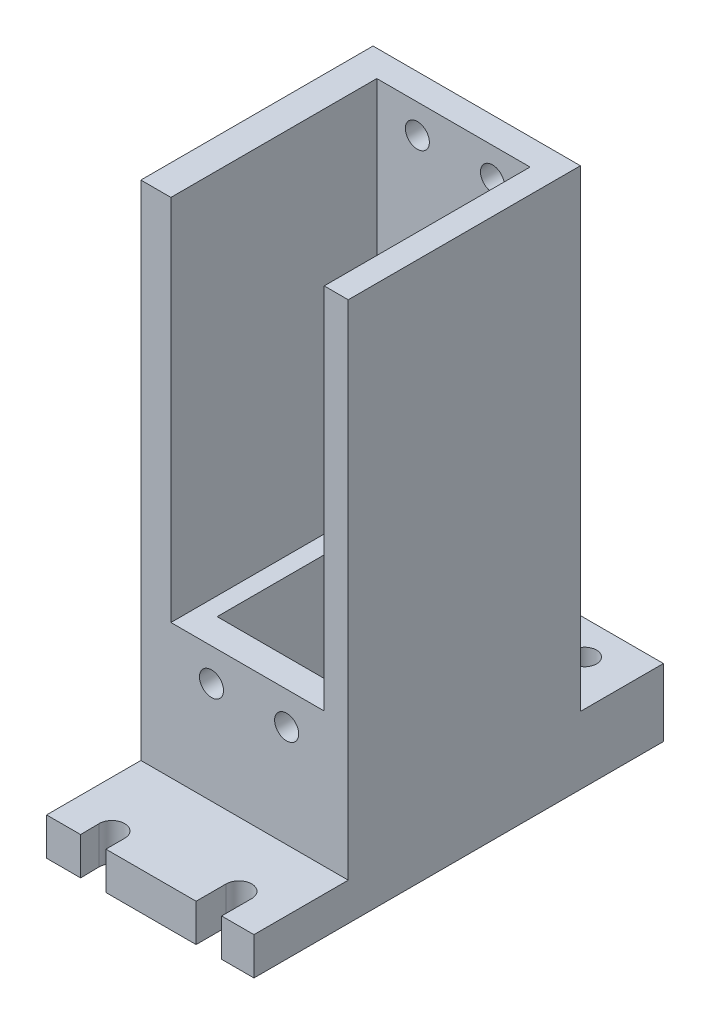
from build123d import *

# Parameters (mm, degrees)
SKETCH1_W               = 25
SKETCH1_H               = 17
BOSS_EXTRUDE1_DEPTH     = 12
MOVE_FACE1_BY           = 15
MOVE_FACE3_BY           = 8
SKETCH3_W               = 25
SKETCH3_H               = 12.751689795
BOSS_EXTRUDE2_DEPTH     = 6.9
SKETCH4_W               = 5
SKETCH4_H               = 16.698310205
BOSS_EXTRUDE3_DEPTH     = 6.9
MOVE_START              = -11.609792285
MOVE_FACE4_OUTLINE_W    = 6.9
MOVE_FACE4_OUTLINE_H    = 16.698310205
MOVE_FACE4_DEPTH        = 2.4
MOVE_FACE5_BY           = 20
SKETCH6_W               = 25
SKETCH6_H               = 10.9
BOSS_EXTRUDE5_DEPTH     = 2
MOVE_FACE6_BY           = 1.5
MOVE_FACE7_BY           = 2.6
SKETCH7_W               = 3.8
SKETCH7_H               = 30.95
BOSS_EXTRUDE6_DEPTH     = 41
SKETCH8_W               = 16.2
SKETCH8_H               = 3.5
BOSS_EXTRUDE7_DEPTH     = 41
SKETCH9_W               = 3
SKETCH9_H               = 30.95
BOSS_EXTRUDE8_DEPTH     = 41
SKETCH10_W              = 4.6
SKETCH10_H              = 3.5
BOSS_EXTRUDE9_DEPTH     = 41
MOVE_FACE8_BY           = 9
MOVE_FACE9_OUTLINE_W    = 6
MOVE_FACE9_OUTLINE_H    = 6.301689795
MOVE_FACE9_OUTLINE_H_2  = 3.5
MOVE_FACE9_DEPTH        = 27.6
MOVE_START_2            = 8.390207715
MOVE_FACE9_2_OUTLINE_W  = 6
MOVE_FACE9_2_OUTLINE_H  = 23.698310205
MOVE_FACE9_2_DEPTH      = 7.6
MOVE_FACE9_3_OUTLINE_W  = 6
MOVE_FACE9_3_OUTLINE_H  = 23.698310205
MOVE_FACE9_3_DEPTH      = 7.4
MOVE_FACE10_BY          = 10
SKETCH11_W              = 27.6
SKETCH11_H              = 3
BOSS_EXTRUDE10_DEPTH    = 11
SKETCH12_R              = 1.5
CUT_EXTRUDE1_DEPTH      = 16
SKETCH13_R              = 1.6
CUT_EXTRUDE2_DEPTH      = 5
SKETCH14_R              = 1.6
CUT_EXTRUDE3_DEPTH      = 9
SKETCH15_R              = 1.6
CUT_EXTRUDE4_DEPTH      = 5
MOVE_FACE14_BY          = 1
MOVE_FACE15_OUTLINE_W   = 16.9
MOVE_FACE15_OUTLINE_H   = 23.698310205
MOVE_FACE15_DEPTH       = 2
MOVE_FACE16_BY          = 8
MOVE_FACE17_BY          = 6
MOVE_FACE19_BY          = 6
MOVE_FACE20_BY          = 5
MOVE_FACE21_BY          = 0.2
MOVE_FACE22_BY          = 0.2
MOVE_START_3            = -12.454005935
MOVE_FACE23_OUTLINE_W   = 27.6
MOVE_FACE23_OUTLINE_H   = 62.9
MOVE_FACE23_DEPTH       = 0.05
MOVE_FACE24_BY          = 0.05
SKETCH17_R              = 1.6
CUT_EXTRUDE5_DEPTH      = 7.5
BOSS_EXTRUDE12_DEPTH    = 2
BOSS_EXTRUDE13_DEPTH    = 46
CUT_EXTRUDE6_DEPTH      = 70.24755409
CUT_EXTRUDE6_DEPTH_BACK = 70.24755409


# Read off the part's stored shape, not the designer's step: Move Face4, Move Face9, Move Face15, Move Face23
with BuildPart() as part:
    # Sketch1 → Boss-Extrude1 (new body)
    with BuildSketch(Plane(origin=(0, 0, 0), x_dir=(1, 0, 0), z_dir=(0, 1, 0))):
        with Locations((0.890207715, 2.454005935)):
            Rectangle(SKETCH1_W, SKETCH1_H)
    extrude(amount=BOSS_EXTRUDE1_DEPTH)

    # Move Face1: a face moved outward by 15.0
    extrude(part.faces().sort_by_distance((0.890207715, 6, 6.045994065))[0], amount=MOVE_FACE1_BY, dir=(0, 0, 1))

    # Move Face3: a face moved inward by 8.0
    extrude(part.faces().sort_by_distance((0.890207715, 12, 5.045994065))[0], amount=MOVE_FACE3_BY, dir=(0, -1, 0), mode=Mode.SUBTRACT)

    # Sketch3 → Boss-Extrude2 (add)
    with BuildSketch(Plane(origin=(0, 4, 0), x_dir=(1, 0, 0), z_dir=(0, 1, 0))):
        with Locations((0.890207715, -12.120149168)):
            Rectangle(SKETCH3_W, SKETCH3_H)
    extrude(amount=BOSS_EXTRUDE2_DEPTH)

    # Sketch4 → Boss-Extrude3 (add)
    with BuildSketch(Plane(origin=(0, 4, 0), x_dir=(1, 0, 0), z_dir=(0, 1, 0))):
        with Locations((10.890207715, 2.604850833)):
            Rectangle(SKETCH4_W, SKETCH4_H)
        with Locations((-6.709792285, 2.604850833)):
            Rectangle(SKETCH4_W, SKETCH4_H)
    extrude(amount=BOSS_EXTRUDE3_DEPTH)

    # Move Face4 outline → Move Face4 (add)
    with BuildSketch(Plane.YZ.offset(MOVE_START)):
        with Locations((7.45, -2.604850833)):
            Rectangle(MOVE_FACE4_OUTLINE_W, MOVE_FACE4_OUTLINE_H)
    extrude(amount=MOVE_FACE4_DEPTH)

    # Move Face5: a face moved inward by 20.0
    extrude(part.faces().sort_by_distance((2.090207715, 4, -2.604850832))[0], amount=MOVE_FACE5_BY, dir=(0, -1, 0), mode=Mode.SUBTRACT)

    # Sketch6 → Boss-Extrude5 (add)
    with BuildSketch(Plane(origin=(0, 0, -10.954005935), x_dir=(-1, 0, 0), z_dir=(0, 0, -1))):
        with Locations((-0.890207715, 5.45)):
            Rectangle(SKETCH6_W, SKETCH6_H)
    extrude(amount=-BOSS_EXTRUDE5_DEPTH)

    # Move Face6: a face moved outward by 1.5
    extrude(part.faces().sort_by_distance((0.890207715, 5.45, -10.954005935))[0], amount=MOVE_FACE6_BY, dir=(0, 0, -1))

    # Move Face7: a face moved outward by 2.6
    extrude(part.faces().sort_by_distance((13.390207715, 5.348749838, 3.512570938))[0], amount=MOVE_FACE7_BY, dir=(1, 0, 0))

    # Sketch7 → Boss-Extrude6 (add)
    with BuildSketch(Plane(origin=(0, 10.9, 0), x_dir=(1, 0, 0), z_dir=(0, 1, 0))):
        with Locations((-9.709792285, -3.020994065)):
            Rectangle(SKETCH7_W, SKETCH7_H)
    extrude(amount=BOSS_EXTRUDE6_DEPTH)

    # Sketch8 → Boss-Extrude7 (add)
    with BuildSketch(Plane(origin=(0, 10.9, 0), x_dir=(1, 0, 0), z_dir=(0, 1, 0))):
        with Locations((0.290207715, 10.704005935)):
            Rectangle(SKETCH8_W, SKETCH8_H)
    extrude(amount=BOSS_EXTRUDE7_DEPTH)

    # Sketch9 → Boss-Extrude8 (add)
    with BuildSketch(Plane(origin=(0, 10.9, 0), x_dir=(1, 0, 0), z_dir=(0, 1, 0))):
        with Locations((14.490207715, -3.020994065)):
            Rectangle(SKETCH9_W, SKETCH9_H)
    extrude(amount=BOSS_EXTRUDE8_DEPTH)

    # Sketch10 → Boss-Extrude9 (add)
    with BuildSketch(Plane(origin=(0, 10.9, 0), x_dir=(1, 0, 0), z_dir=(0, 1, 0))):
        with Locations((10.690207715, 10.704005935)):
            Rectangle(SKETCH10_W, SKETCH10_H)
    extrude(amount=BOSS_EXTRUDE9_DEPTH)

    # Move Face8: a face moved inward by 9.0
    extrude(part.faces().sort_by_distance((2.090207715, 5.45, 5.74430427))[0], amount=MOVE_FACE8_BY, dir=(0, 0, 1), mode=Mode.SUBTRACT)

    # Move Face9 outline → Move Face9 (add)
    with BuildSketch(Plane.YZ.offset(MOVE_START)):
        with Locations((-3, 17.895149168)):
            Rectangle(MOVE_FACE9_OUTLINE_W, MOVE_FACE9_OUTLINE_H)
        with Locations((-3, -10.704005935)):
            Rectangle(MOVE_FACE9_OUTLINE_W, MOVE_FACE9_OUTLINE_H_2)
    extrude(amount=MOVE_FACE9_DEPTH)

    # Move Face9 2 outline → Move Face9 2 (add)
    with BuildSketch(Plane.YZ.offset(MOVE_START_2)):
        with Locations((-3, 2.895149167)):
            Rectangle(MOVE_FACE9_2_OUTLINE_W, MOVE_FACE9_2_OUTLINE_H)
    extrude(amount=MOVE_FACE9_2_DEPTH)

    # Move Face9 3 outline → Move Face9 3 (add)
    with BuildSketch(Plane.YZ.offset(MOVE_START)):
        with Locations((-3, 2.895149167)):
            Rectangle(MOVE_FACE9_3_OUTLINE_W, MOVE_FACE9_3_OUTLINE_H)
    extrude(amount=MOVE_FACE9_3_DEPTH)

    # Move Face10: a face moved outward by 10.0
    extrude(part.faces().sort_by_distance((2.190207715, -1, 21.045994065))[0], amount=MOVE_FACE10_BY, dir=(0, 0, 1))

    # Sketch11 → Boss-Extrude10 (add)
    with BuildSketch(Plane(origin=(0, 0, -12.454005935), x_dir=(-1, 0, 0), z_dir=(0, 0, -1))):
        with Locations((-2.190207715, -4.5)):
            Rectangle(SKETCH11_W, SKETCH11_H)
    extrude(amount=BOSS_EXTRUDE10_DEPTH)

    # Sketch12 → Cut-Extrude1 (cut)
    with BuildSketch(Plane.XZ.offset(6)):
        with Locations(Location((-5.378312816, -20.454005935, 0), (0, 0, 270))):
            Circle(SKETCH12_R)
        with BuildLine():
            Line((-3.715791402, 28.545994065), (-3.715791402, 31.045994065))
            Line((-3.715791402, 31.045994065), (-7.07410382, 31.045994065))
            Line((-7.07410382, 31.045994065), (-7.115791402, 28.545994065))
            ThreePointArc((-7.115791402, 28.545994065), (-5.415791402, 26.845994065), (-3.715791402, 28.545994065))
        make_face()
    extrude(amount=-CUT_EXTRUDE1_DEPTH, mode=Mode.SUBTRACT)

    # Sketch13 → Cut-Extrude2 (cut)
    with BuildSketch(Plane(origin=(0, -3, 0), x_dir=(1, 0, 0), z_dir=(0, 1, 0))):
        with Locations(Location((9.990207715, 18.954005935, 0), (0, 0, 180))):
            Circle(SKETCH13_R)
        with BuildLine():
            Line((11.690207715, -27.045994065), (11.690207715, -31.045994065))
            Line((11.690207715, -31.045994065), (8.290207715, -31.045994065))
            Line((8.290207715, -31.045994065), (8.290207715, -27.045994065))
            ThreePointArc((8.290207715, -27.045994065), (9.990207715, -25.345994065), (11.690207715, -27.045994065))
        make_face()
    extrude(amount=-CUT_EXTRUDE2_DEPTH, mode=Mode.SUBTRACT)

    # Sketch14 → Cut-Extrude3 (cut)
    with BuildSketch(Plane.XZ.offset(3)):
        with Locations((9.990207715, 27.045994065)):
            Circle(SKETCH14_R)
    extrude(amount=-CUT_EXTRUDE3_DEPTH, mode=Mode.SUBTRACT)

    # Sketch15 → Cut-Extrude4 (cut)
    with BuildSketch(Plane.XY.offset(18.495994065)):
        with Locations((-2.209792285, 6.55)):
            Circle(SKETCH15_R)
        with Locations((7.790207715, 6.55)):
            Circle(SKETCH15_R)
    extrude(amount=-CUT_EXTRUDE4_DEPTH, mode=Mode.SUBTRACT)

    # Move Face14: a face moved inward by 1.0
    extrude(part.faces().sort_by_distance((-4.209792285, 2.45, 2.895149168))[0], amount=MOVE_FACE14_BY, dir=(-1, 0, 0), mode=Mode.SUBTRACT)

    # Move Face15 outline → Move Face15 (cut)
    with BuildSketch(Plane.YZ.offset(MOVE_START_2)):
        with Locations((2.45, 2.895149167)):
            Rectangle(MOVE_FACE15_OUTLINE_W, MOVE_FACE15_OUTLINE_H)
    extrude(amount=MOVE_FACE15_DEPTH, mode=Mode.SUBTRACT)

    # Move Face16: a face moved outward by 8.0
    extrude(part.faces().sort_by_distance((2.190207715, 51.9, -9.359005935))[0], amount=MOVE_FACE16_BY, dir=(0, 1, 0))

    # Move Face17: a face moved inward by 6.0
    extrude(part.faces().sort_by_distance((2.300746103, 4, 24.541741789))[0], amount=MOVE_FACE17_BY, dir=(0, -1, 0), mode=Mode.SUBTRACT)

    # Move Face19: a face moved outward by 6.0
    extrude(part.faces().sort_by_distance((13.230207715, -6, 3.795994065))[0], amount=MOVE_FACE19_BY, dir=(0, -1, 0))

    # Move Face20: a face moved inward by 5.0
    extrude(part.faces().sort_by_distance((2.300746103, -2, 24.541741789))[0], amount=MOVE_FACE20_BY, dir=(0, -1, 0), mode=Mode.SUBTRACT)

    # Move Face21: a face moved outward by 0.2
    extrude(part.faces().sort_by_distance((-7.809792285, 35.4, 4.770994065))[0], amount=MOVE_FACE21_BY, dir=(1, 0, 0))

    # Move Face22: a face moved outward by 0.2
    extrude(part.faces().sort_by_distance((12.990207715, 35.4, 4.770994065))[0], amount=MOVE_FACE22_BY, dir=(-1, 0, 0))

    # Move Face23 outline → Move Face23 (cut)
    with BuildSketch(Plane.XY.offset(MOVE_START_3)):
        with Locations((2.190207715, 28.45)):
            Rectangle(MOVE_FACE23_OUTLINE_W, MOVE_FACE23_OUTLINE_H)
    extrude(amount=MOVE_FACE23_DEPTH, mode=Mode.SUBTRACT)

    # Move Face24: a face moved outward by 0.05
    extrude(part.faces().sort_by_distance((2.590207715, 25.934788184, -8.954005935))[0], amount=MOVE_FACE24_BY, dir=(0, 0, 1))

    # Sketch17 → Cut-Extrude5 (cut)
    with BuildSketch(Plane.XY.offset(-8.904005935)):
        with Locations((-2.209792285, 56.05)):
            Circle(SKETCH17_R)
        with Locations((7.790207715, 56.05)):
            Circle(SKETCH17_R)
    extrude(amount=-CUT_EXTRUDE5_DEPTH, mode=Mode.SUBTRACT)

    # Sketch19 → Boss-Extrude12 (add)
    with BuildSketch(Plane(origin=(3.990207715, 0, 0), x_dir=(0, 0, -1), z_dir=(1, 0, 0))):
        Polygon((23.454005935, -3), (12.404005935, 43), (12.404005935, -3), align=None)
    extrude(amount=-BOSS_EXTRUDE12_DEPTH)

    # Sketch20 → Boss-Extrude13 (add)
    with BuildSketch(Plane(origin=(0, -3, 0), x_dir=(1, 0, 0), z_dir=(0, 1, 0))):
        Polygon((1.990207715, 15.804005935), (-1.409792285, 12.404005935), (1.990207715, 12.404005935), align=None)
        Polygon((3.990207715, 15.804005935), (7.390207715, 12.404005935), (3.990207715, 12.404005935), align=None)
    extrude(amount=BOSS_EXTRUDE13_DEPTH)

    # Sketch21 → Cut-Extrude6 (cut, two sides: drawn at the far end of the back side and taken through both)
    with BuildSketch(Plane(origin=(3.990207715, 0, 0), x_dir=(0, 0, -1), z_dir=(1, 0, 0)).offset(-CUT_EXTRUDE6_DEPTH_BACK)):
        Polygon((15.902869946, 28.434593255), (12.404005935, 43), (16.038201458, 43), align=None)
    extrude(amount=CUT_EXTRUDE6_DEPTH + CUT_EXTRUDE6_DEPTH_BACK, mode=Mode.SUBTRACT)


solid = part.part
